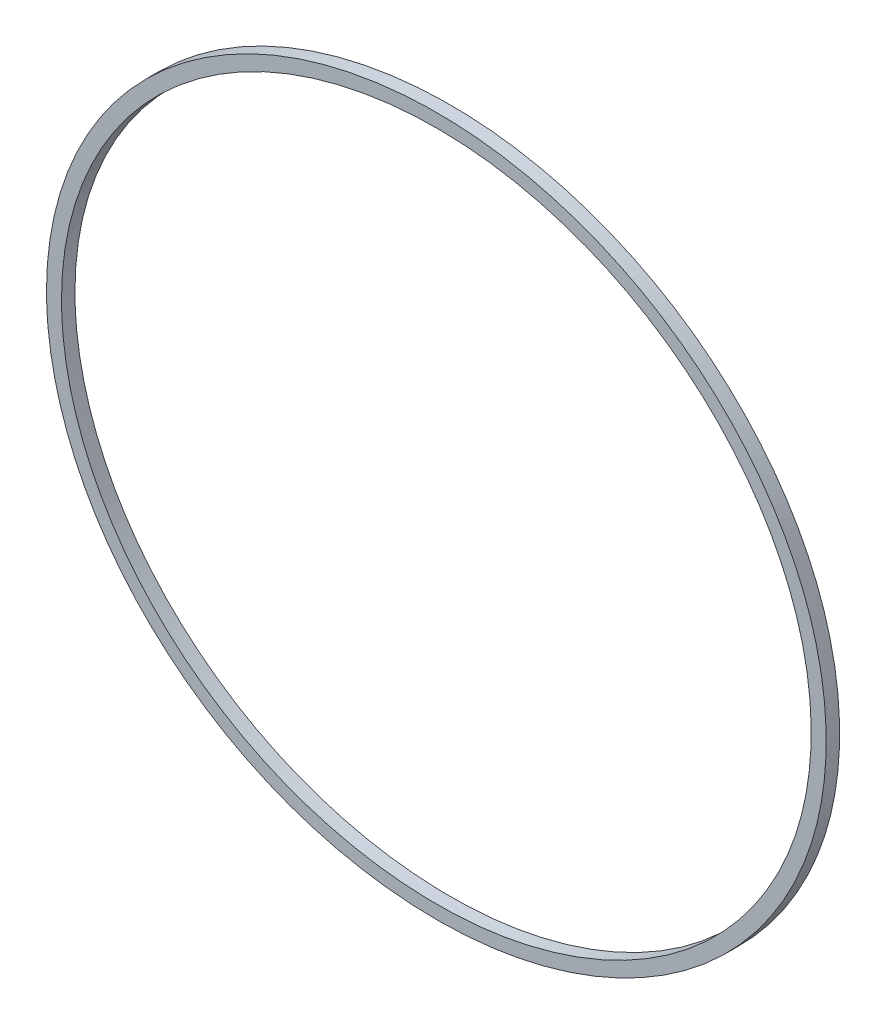
from build123d import *

# Parameters (mm, degrees)
SKETCH1_R           = 52
SKETCH1_R_2         = 50
BOSS_EXTRUDE5_DEPTH = 2
FLEX1_START         = 1.4e-08
FLEX1_DEPTH         = 2
FLEX1_2_DEPTH       = 2


# Read off the part's stored shape, not the designer's step: Flex1
with BuildPart() as part:
    # Sketch1 → Boss-Extrude5 (new body)
    with BuildSketch(Plane.XY):
        with Locations((-19.870639263, -20.903178587)):
            Circle(SKETCH1_R)
        with Locations((-19.870639263, -20.903178587)):
            Circle(SKETCH1_R_2, mode=Mode.SUBTRACT)
    extrude(amount=BOSS_EXTRUDE5_DEPTH)

    # Flex1 outline → Flex1 (cut)
    with BuildSketch(Plane.XY.offset(FLEX1_START)):
        with BuildLine():
            add(Edge.make_bspline(
                [(-52.111598115, 19.89535781), (-49.259973715, 21.710211346), (-39.771716428, 26.62541894), (-28.936557706, 28.861447047), (-21.531674471, 29.069223416)],
                knots=[0.954377741, 0.954377741, 0.954377741, 0.954377741, 1.142397329, 1.540991543, 1.540991543, 1.540991543, 1.540991543], degree=3))
            ThreePointArc((-52.111598115, 19.89535781), (-71.870639262, -20.903178585), (-52.11159812, -61.701714982))
            add(Edge.make_bspline(
                [(-21.531674651, -70.875580586), (-28.936557825, -70.667804198), (-39.771716482, -68.431776088), (-49.259973719, -63.516568519), (-52.11159812, -61.701714982)],
                knots=[4.742193767, 4.742193767, 4.742193767, 4.742193767, 5.140787979, 5.328807566, 5.328807566, 5.328807566, 5.328807566], degree=3))
            ThreePointArc((-21.531674651, -70.875580586), (-69.870639262, -20.903178498), (-21.531674471, 29.069223416))
        make_face()
        with BuildLine():
            ThreePointArc((-18.927406296, 31.088266012), (-20.262890455, 31.095341958), (-21.598115883, 31.068119496))
            add(Edge.make_bspline(
                [(-21.598115883, 31.068119496), (-20.708160749, 31.093091078), (-19.817614297, 31.099846493), (-18.927406296, 31.088266012)],
                knots=[1.540991543, 1.540991543, 1.540991543, 1.540991543, 1.587054048, 1.587054048, 1.587054048, 1.587054048], degree=3))
        make_face()
        with BuildLine():
            add(Edge.make_bspline(
                [(-18.927406116, -72.894623185), (-19.817614236, -72.90620367), (-20.708160809, -72.899448253), (-21.598116062, -72.874476666)],
                knots=[4.696131256, 4.696131256, 4.696131256, 4.696131256, 4.742193767, 4.742193767, 4.742193767, 4.742193767], degree=3))
            ThreePointArc((-21.598116062, -72.874476666), (-20.262890454, -72.901699134), (-18.927406116, -72.894623185))
        make_face()
        with BuildLine():
            add(Edge.make_bspline(
                [(-18.96368449, 29.088595066), (-16.612183804, 29.058005013), (-8.961453794, 28.52500913), (1.859665963, 25.655472535), (9.527572068, 21.697910418), (12.382918268, 19.885398571)],
                knots=[1.587054048, 1.587054048, 1.587054048, 1.587054048, 1.713595993, 1.999195325, 2.187457348, 2.187457348, 2.187457348, 2.187457348], degree=3))
            ThreePointArc((-18.96368449, 29.088595066), (30.129360738, -20.903178498), (-18.96368431, -70.894952238))
            add(Edge.make_bspline(
                [(12.382918274, -61.691755743), (9.527572073, -63.504267591), (1.859665965, -67.461829709), (-8.961453736, -70.331366289), (-16.612183683, -70.86436218), (-18.96368431, -70.894952238)],
                knots=[4.095727959, 4.095727959, 4.095727959, 4.095727959, 4.283989982, 4.569589314, 4.696131256, 4.696131256, 4.696131256, 4.696131256], degree=3))
            ThreePointArc((12.382918274, -61.691755743), (32.129360738, -20.903178584), (12.382918268, 19.885398571))
        make_face()
    extrude(amount=FLEX1_DEPTH, mode=Mode.SUBTRACT)

    # Flex1 2 outline → Flex1 2 (add)
    with BuildSketch(Plane.XY.offset(FLEX1_START)):
        with BuildLine():
            add(Edge.make_bspline(
                [(-52.11159812, -61.701714982), (-53.591554469, -60.759829363), (-59.202637907, -56.807945867), (-67.429609726, -48.30944906), (-74.112932744, -35.181244755), (-75.639880487, -25.662533977), (-75.639880487, -20.903178588)],
                knots=[5.328807566, 5.328807566, 5.328807566, 5.328807566, 5.426387311, 5.711986643, 5.997585975, 6.283185307, 6.283185307, 6.283185307, 6.283185307], degree=3))
            add(Edge.make_bspline(
                [(-75.639880487, -20.903178588), (-75.639880486, -16.143823198), (-74.112932744, -6.62511242), (-67.429609726, 6.503091885), (-59.202637905, 15.001588693), (-53.591554465, 18.953472191), (-52.111598115, 19.89535781)],
                knots=[0, 0, 0, 0, 0.285599332, 0.571198664, 0.856797996, 0.954377741, 0.954377741, 0.954377741, 0.954377741], degree=3))
            ThreePointArc((-52.111598115, 19.89535781), (-37.749993363, 27.926409747), (-21.598115883, 31.068119496))
            add(Edge.make_bspline(
                [(-77.870650135, -20.903178588), (-77.870650135, -15.953448983), (-76.282624482, -6.053989774), (-69.331968545, 7.599342704), (-58.370479673, 18.922607232), (-42.442218833, 28.139734754), (-29.299194446, 30.852032072), (-21.598115883, 31.068119496)],
                knots=[0, 0, 0, 0, 0.285599332, 0.571198664, 0.856797996, 1.142397329, 1.540991543, 1.540991543, 1.540991543, 1.540991543], degree=3))
            add(Edge.make_bspline(
                [(-21.598116062, -72.874476666), (-29.299194565, -72.658389223), (-42.442218884, -69.9460919), (-58.370479673, -60.728964407), (-69.331968544, -49.405699878), (-76.282624483, -35.752367402), (-77.870650136, -25.852908192), (-77.870650135, -20.903178588)],
                knots=[4.742193767, 4.742193767, 4.742193767, 4.742193767, 5.140787979, 5.426387311, 5.711986643, 5.997585975, 6.283185307, 6.283185307, 6.283185307, 6.283185307], degree=3))
            ThreePointArc((-21.598116062, -72.874476666), (-37.74999345, -69.732766891), (-52.11159812, -61.701714982))
        make_face()
        with BuildLine():
            ThreePointArc((-18.96368449, 29.088595066), (-20.24780387, 29.09539886), (-21.531674471, 29.069223416))
            add(Edge.make_bspline(
                [(-21.531674471, 29.069223416), (-20.675948383, 29.093234552), (-19.81965372, 29.099730144), (-18.96368449, 29.088595066)],
                knots=[1.540991543, 1.540991543, 1.540991543, 1.540991543, 1.587054048, 1.587054048, 1.587054048, 1.587054048], degree=3))
        make_face()
        with BuildLine():
            add(Edge.make_bspline(
                [(-18.96368431, -70.894952238), (-19.819653659, -70.90608732), (-20.675948443, -70.899591728), (-21.531674651, -70.875580586)],
                knots=[4.696131256, 4.696131256, 4.696131256, 4.696131256, 4.742193767, 4.742193767, 4.742193767, 4.742193767], degree=3))
            ThreePointArc((-21.531674651, -70.875580586), (-20.24780387, -70.901756036), (-18.96368431, -70.894952238))
        make_face()
        with BuildLine():
            add(Edge.make_bspline(
                [(-18.927406296, 31.088266012), (-16.481845583, 31.056452357), (-8.525086375, 30.502136638), (4.553369527, 27.034001301), (18.635407254, 18.938146484), (29.577620593, 7.593357825), (38.894113149, -10.600569187), (38.894113149, -31.205787988), (29.577620593, -49.399715), (18.635407254, -60.744503659), (4.553369527, -68.840358476), (-8.525086316, -72.308493798), (-16.481845463, -72.862809524), (-18.927406116, -72.894623185)],
                knots=[1.587054048, 1.587054048, 1.587054048, 1.587054048, 1.713595993, 1.999195325, 2.284794657, 2.570393989, 2.855993321, 3.427191986, 3.712791318, 3.99839065, 4.283989982, 4.569589314, 4.696131256, 4.696131256, 4.696131256, 4.696131256], degree=3))
            ThreePointArc((-18.927406296, 31.088266012), (-2.352569034, 28.057185131), (12.382918268, 19.885398571))
            add(Edge.make_bspline(
                [(12.382918268, 19.885398571), (13.859220884, 18.948273686), (19.466236645, 15.008901993), (27.675764444, 6.497337194), (36.633930364, -10.996823395), (36.633930364, -30.809533781), (27.675764444, -48.303694369), (19.466236646, -56.815259167), (13.859220888, -60.754630858), (12.382918274, -61.691755743)],
                knots=[2.187457348, 2.187457348, 2.187457348, 2.187457348, 2.284794657, 2.570393989, 2.855993321, 3.427191986, 3.712791318, 3.99839065, 4.095727959, 4.095727959, 4.095727959, 4.095727959], degree=3))
            ThreePointArc((12.382918274, -61.691755743), (-2.352568945, -69.863542275), (-18.927406116, -72.894623185))
        make_face()
    extrude(amount=FLEX1_2_DEPTH)


solid = part.part
